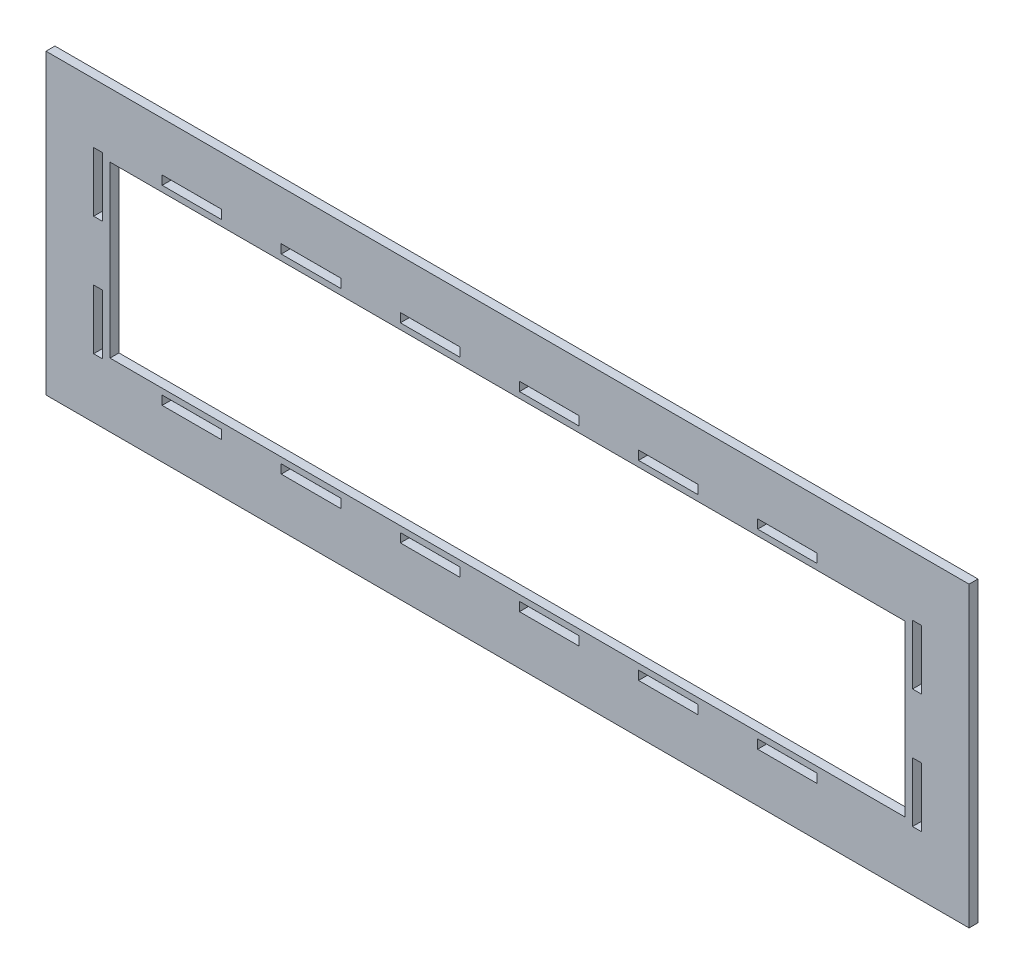
from build123d import *

# Parameters (mm, degrees)
CROQUIS1_W                = 620
CROQUIS1_H                = 200
CROQUIS1_W_2              = 534
CROQUIS1_H_2              = 114
SALIENTE_EXTRUIR1_DEPTH   = 6
CROQUIS2_W                = 6.02
CROQUIS2_H                = 40
CORTAR_EXTRUIR1_DEPTH     = 6
CROQUIS3_W                = 40
CROQUIS3_H                = 6.02
CORTAR_EXTRUIR2_DEPTH     = 6
MATRIZL1_COUNT            = 6
MATRIZL1_PITCH            = 80
SIMETR_A1_COPY_1_SKETCH_W = 40
SIMETR_A1_COPY_1_SKETCH_H = 6.02
SIMETR_A1_COPY_1_DEPTH    = 6
SIMETR_A1_COPY_2_SKETCH_W = 40
SIMETR_A1_COPY_2_SKETCH_H = 6.02
SIMETR_A1_COPY_2_DEPTH    = 6
SIMETR_A1_COPY_3_SKETCH_W = 40
SIMETR_A1_COPY_3_SKETCH_H = 6.02
SIMETR_A1_COPY_3_DEPTH    = 6
SIMETR_A1_COPY_4_SKETCH_W = 40
SIMETR_A1_COPY_4_SKETCH_H = 6.02
SIMETR_A1_COPY_4_DEPTH    = 6
SIMETR_A1_COPY_5_SKETCH_W = 40
SIMETR_A1_COPY_5_SKETCH_H = 6.02
SIMETR_A1_COPY_5_DEPTH    = 6
SIMETR_A1_COPY_6_SKETCH_W = 40
SIMETR_A1_COPY_6_SKETCH_H = 6.02
SIMETR_A1_COPY_6_DEPTH    = 6


with BuildPart() as part:
    # Croquis1 → Saliente-Extruir1 (new body)
    with BuildSketch(Plane.XY):
        Rectangle(CROQUIS1_W, CROQUIS1_H)
        Rectangle(CROQUIS1_W_2, CROQUIS1_H_2, mode=Mode.SUBTRACT)
    extrude(amount=SALIENTE_EXTRUIR1_DEPTH)

    # Croquis2 → Cortar-Extruir1 (cut)
    with BuildSketch(Plane.XY.offset(6)):
        with Locations((-275.01, 40)):
            Rectangle(CROQUIS2_W, CROQUIS2_H)
        with Locations((-275.01, -40)):
            Rectangle(CROQUIS2_W, CROQUIS2_H)
        with Locations((275.01, -40)):
            Rectangle(CROQUIS2_W, CROQUIS2_H)
        with Locations((275.01, 40)):
            Rectangle(CROQUIS2_W, CROQUIS2_H)
    extrude(amount=-CORTAR_EXTRUIR1_DEPTH, mode=Mode.SUBTRACT)

    # Croquis3 → Cortar-Extruir2 (cut)
    with BuildSketch(Plane.XY.offset(6)):
        with Locations((-212, 64.01)):
            Rectangle(CROQUIS3_W, CROQUIS3_H)
    cortar_extruir2 = extrude(amount=-CORTAR_EXTRUIR2_DEPTH, mode=Mode.SUBTRACT)

    # MatrizL1: Cortar-Extruir2 ×6
    with Locations(*[(i * MATRIZL1_PITCH, 0, 0) for i in range(1, MATRIZL1_COUNT)]):
        add(cortar_extruir2, mode=Mode.SUBTRACT)

    # Simetría1 copy 1 sketch → Simetría1 copy 1 (cut)
    with BuildSketch(Plane(origin=(80, 0, 6), x_dir=(1, 0, 0), z_dir=(0, 0, 1))):
        with Locations((-212, -64.01)):
            Rectangle(SIMETR_A1_COPY_1_SKETCH_W, SIMETR_A1_COPY_1_SKETCH_H)
    extrude(amount=-SIMETR_A1_COPY_1_DEPTH, mode=Mode.SUBTRACT)

    # Simetría1 copy 2 sketch → Simetría1 copy 2 (cut)
    with BuildSketch(Plane(origin=(160, 0, 6), x_dir=(1, 0, 0), z_dir=(0, 0, 1))):
        with Locations((-212, -64.01)):
            Rectangle(SIMETR_A1_COPY_2_SKETCH_W, SIMETR_A1_COPY_2_SKETCH_H)
    extrude(amount=-SIMETR_A1_COPY_2_DEPTH, mode=Mode.SUBTRACT)

    # Simetría1 copy 3 sketch → Simetría1 copy 3 (cut)
    with BuildSketch(Plane(origin=(240, 0, 6), x_dir=(1, 0, 0), z_dir=(0, 0, 1))):
        with Locations((-212, -64.01)):
            Rectangle(SIMETR_A1_COPY_3_SKETCH_W, SIMETR_A1_COPY_3_SKETCH_H)
    extrude(amount=-SIMETR_A1_COPY_3_DEPTH, mode=Mode.SUBTRACT)

    # Simetría1 copy 4 sketch → Simetría1 copy 4 (cut)
    with BuildSketch(Plane(origin=(320, 0, 6), x_dir=(1, 0, 0), z_dir=(0, 0, 1))):
        with Locations((-212, -64.01)):
            Rectangle(SIMETR_A1_COPY_4_SKETCH_W, SIMETR_A1_COPY_4_SKETCH_H)
    extrude(amount=-SIMETR_A1_COPY_4_DEPTH, mode=Mode.SUBTRACT)

    # Simetría1 copy 5 sketch → Simetría1 copy 5 (cut)
    with BuildSketch(Plane(origin=(400, 0, 6), x_dir=(1, 0, 0), z_dir=(0, 0, 1))):
        with Locations((-212, -64.01)):
            Rectangle(SIMETR_A1_COPY_5_SKETCH_W, SIMETR_A1_COPY_5_SKETCH_H)
    extrude(amount=-SIMETR_A1_COPY_5_DEPTH, mode=Mode.SUBTRACT)

    # Simetría1 copy 6 sketch → Simetría1 copy 6 (cut)
    with BuildSketch(Plane.XY.offset(6)):
        with Locations((-212, -64.01)):
            Rectangle(SIMETR_A1_COPY_6_SKETCH_W, SIMETR_A1_COPY_6_SKETCH_H)
    extrude(amount=-SIMETR_A1_COPY_6_DEPTH, mode=Mode.SUBTRACT)


solid = part.part
